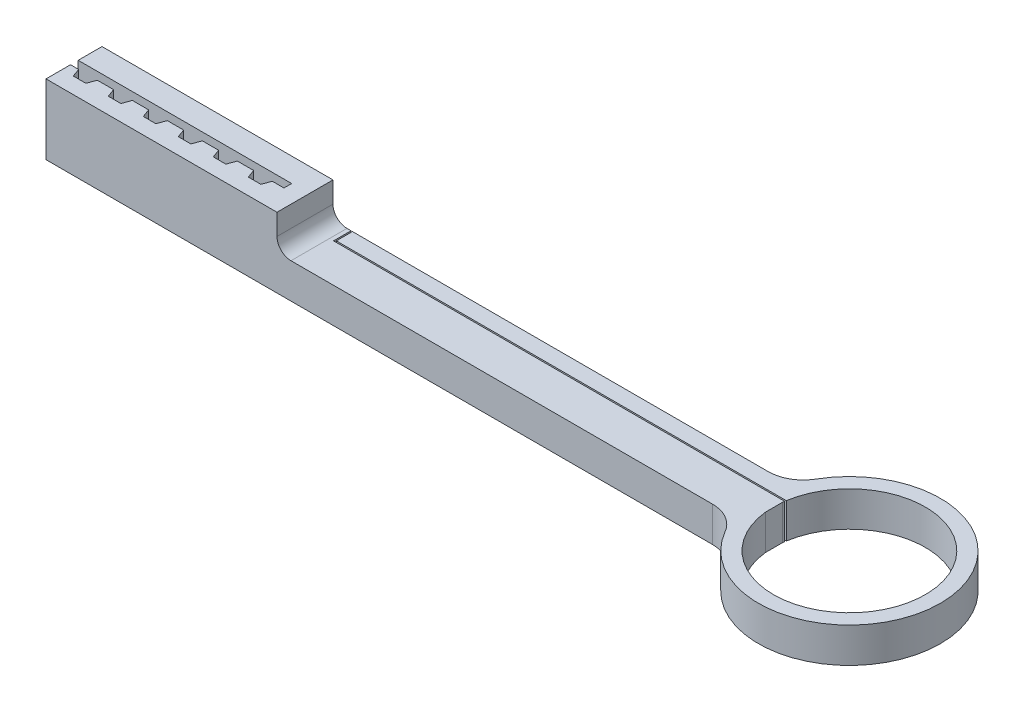
from build123d import *

# Parameters (mm, degrees)
SKETCH_1_R          = 13
SKETCH_1_R_2        = 10.85
RING_DEPTH          = 5
SKETCH_2_W          = 100
SKETCH_2_H          = 8
STICK_DEPTH         = 5
SKETCH_3_W          = 33
SKETCH_3_H          = 8
KEY_DEPTH           = 10
FILLET_1_R          = 5
FILLET_5_R          = 2
KEY_HOLE_DEPTH      = 112.793943777
KEY_HOLE_DEPTH_BACK = 112.793943777
CUT_EXTRUDE_2_DEPTH = 112.98944533


with BuildPart() as part:
    # Эскиз1 → ring (new body)
    with BuildSketch(Plane(origin=(0, 0, 0), x_dir=(1, 0, 0), z_dir=(0, 1, 0))):
        Circle(SKETCH_1_R)
        Circle(SKETCH_1_R_2, mode=Mode.SUBTRACT)
    extrude(amount=RING_DEPTH)

    # Эскиз2 → stick (add)
    with BuildSketch(Plane(origin=(0, 0, 0), x_dir=(1, 0, 0), z_dir=(0, 1, 0))):
        with Locations((-60.781929326, 0)):
            Rectangle(SKETCH_2_W, SKETCH_2_H)
    extrude(amount=STICK_DEPTH)

    # Эскиз3 → key (add)
    with BuildSketch(Plane(origin=(0, 0, 0), x_dir=(1, 0, 0), z_dir=(0, 1, 0))):
        with Locations((-94.281929326, 0)):
            Rectangle(SKETCH_3_W, SKETCH_3_H)
    extrude(amount=KEY_DEPTH)

    # Скругление1
    fillet_1_edges = [part.edges().sort_by_distance(p)[0] for p in [
        (-12.369316877, 2.5, 4),
        (-12.369316877, 2.5, -4),
    ]]
    fillet(fillet_1_edges, radius=FILLET_1_R)

    # Скругление5
    fillet_5_edges = [part.edges().sort_by_distance(p)[0] for p in [
        (-77.781929326, 5, 0),
    ]]
    fillet(fillet_5_edges, radius=FILLET_5_R)

    # Эскиз4 → key hole (cut, two sides: drawn at the far end of the back side and taken through both)
    with BuildSketch(Plane(origin=(0, 2.5, 0), x_dir=(1, 0, 0), z_dir=(0, 1, 0)).offset(-KEY_HOLE_DEPTH_BACK)):
        Polygon((-110.781929326, 0.6), (-80.281929326, 0.6), (-80.281929326, -0.5), (-80.781929326, -0.5), (-81.945165045, -0.5), (-82.381929326, -1.7), (-84.181929326, -1.7), (-84.618693608, -0.5), (-85.781929326, -0.5), (-86.945165045, -0.5), (-87.381929326, -1.7), (-89.181929326, -1.7), (-89.618693608, -0.5), (-90.781929326, -0.5), (-91.945165045, -0.5), (-92.381929326, -1.7), (-94.181929326, -1.7), (-94.618693608, -0.5), (-95.781929326, -0.5), (-96.945165045, -0.5), (-97.381929326, -1.7), (-99.181929326, -1.7), (-99.618693608, -0.5), (-100.781929326, -0.5), (-101.945165045, -0.5), (-102.381929326, -1.7), (-104.181929326, -1.7), (-104.618693608, -0.5), (-105.781929326, -0.5), (-106.945165045, -0.5), (-107.381929326, -1.7), (-109.181929326, -1.7), (-109.618693608, -0.5), (-110.781929326, -0.5), align=None)
    extrude(amount=KEY_HOLE_DEPTH + KEY_HOLE_DEPTH_BACK, mode=Mode.SUBTRACT)

    # Эскиз5 → Вытянуть2 (cut, through all)
    with BuildSketch(Plane.XZ):
        Polygon((-75.2, -4), (-75.2, -1.5), (0, -1.5), (0, -1.7), (-75, -1.7), (-75, -4), align=None)
    extrude(amount=-CUT_EXTRUDE_2_DEPTH, mode=Mode.SUBTRACT)


solid = part.part
